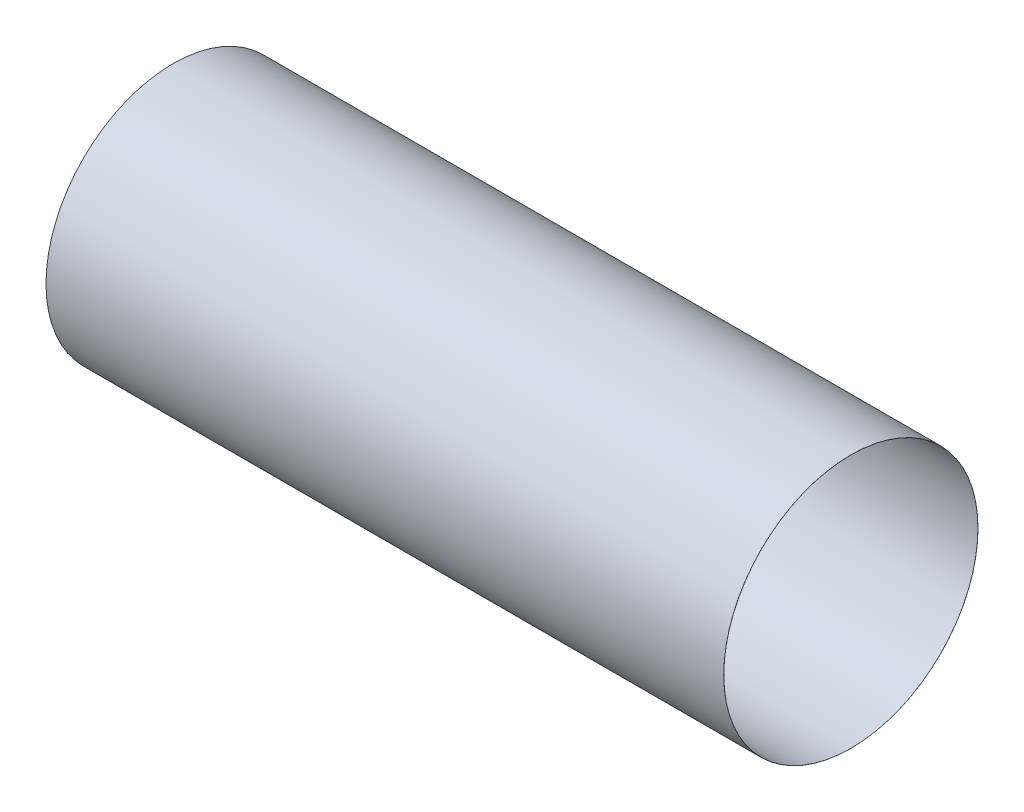
from build123d import *

# Parameters (mm, degrees)
SKETCH2_R           = 57.1754
SKETCH2_R_2         = 57.15
EXTRUDE_THIN1_DEPTH = 304.8


with BuildPart() as part:
    # Sketch2 → Extrude-Thin1 (new body)
    with BuildSketch(Plane(origin=(0, 0, 0), x_dir=(0, 0, -1), z_dir=(1, 0, 0))):
        Circle(SKETCH2_R)
        Circle(SKETCH2_R_2, mode=Mode.SUBTRACT)
    extrude(amount=EXTRUDE_THIN1_DEPTH)


solid = part.part
